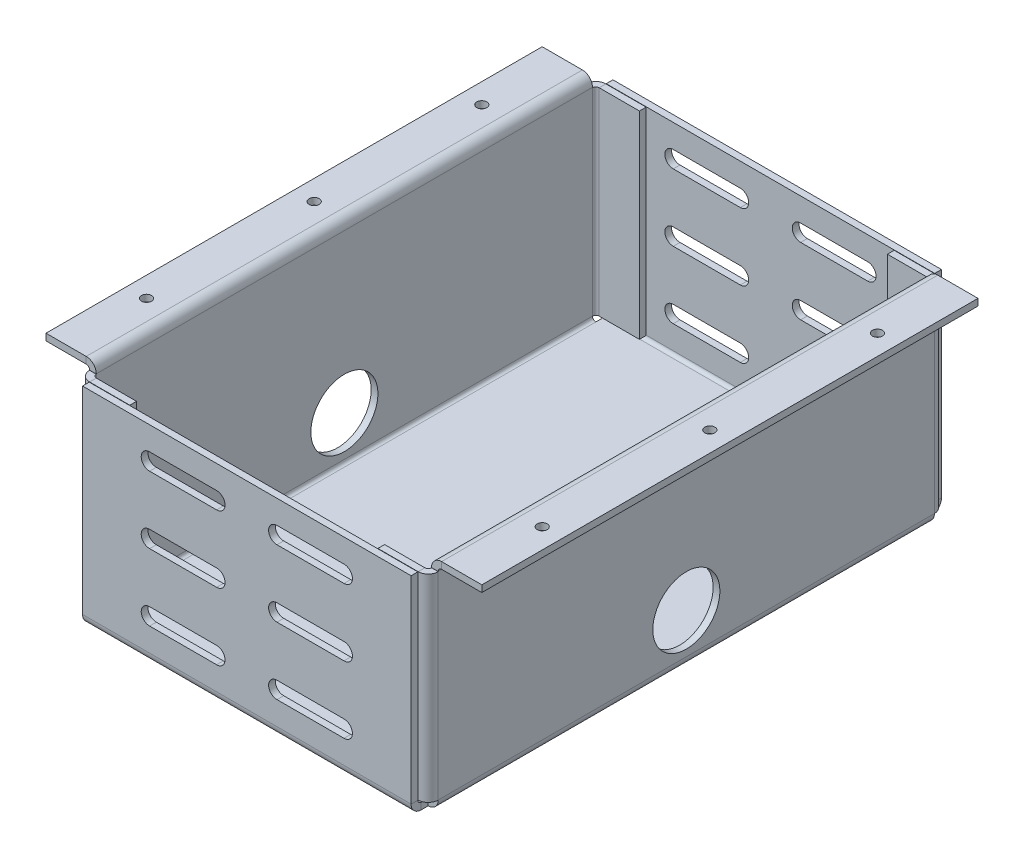
from build123d import *

# Parameters (mm, degrees)
BRIDA_BASE1_DEPTH           = 75
BRIDA_START                 = -3
BRIDA_DE_ARISTA1_OUTLINE_W  = 3
BRIDA_DE_ARISTA1_OUTLINE_H  = 1
BRIDA_DE_ARISTA1_DEPTH      = 4
BRIDA_START_2               = 1
BRIDA_DE_ARISTA1_2_DEPTH    = 59
BRIDA_DE_ARISTA1_3_DEPTH    = 59
BRIDA_DE_ARISTA3_DEPTH      = 98
BRIDA_DE_ARISTA4_DEPTH      = 98
BRIDA_DE_ARISTA5_DEPTH      = 148
BRIDA_DE_ARISTA5_BEND_DEPTH = 148
CORTAR_EXTRUIR1_REACH       = 122.264
CROQUIS32_R                 = 1.5
CORTAR_EXTRUIR2_REACH       = 184.302
DESDOBLAR1_OUTLINE_R        = 1.5
DESDOBLAR1_DEPTH            = 63.1
DESDOBLAR1_START            = -2
DESDOBLAR1_2_OUTLINE_R      = 1.5
DESDOBLAR1_2_DEPTH          = 2
DOBLAR1_START               = -2
DOBLAR1_OUTLINE_W           = 98
DOBLAR1_OUTLINE_H           = 59.141592654
DOBLAR1_OUTLINE_R           = 1.5
DOBLAR1_DEPTH               = 2
DOBLAR1_START_2             = 1
DOBLAR1_2_OUTLINE_W         = 98
DOBLAR1_2_OUTLINE_H         = 2
DOBLAR1_2_DEPTH             = 59
DOBLAR1_3_DEPTH             = 1
DOBLAR1_START_3             = 60.1
DOBLAR1_4_OUTLINE_W         = 15
DOBLAR1_4_OUTLINE_H         = 148
DOBLAR1_4_OUTLINE_R         = 1.5
DOBLAR1_4_DEPTH             = 3
DOBLAR1_5_OUTLINE_W         = 12
DOBLAR1_5_OUTLINE_H         = 2
DOBLAR1_5_DEPTH             = 0.68314
DOBLAR1_START_4             = 60
DOBLAR1_6_OUTLINE_W         = 2
DOBLAR1_6_OUTLINE_H         = 148
DOBLAR1_6_DEPTH             = 1.1
DOBLAR1_START_5             = -76.1
DOBLAR1_7_DEPTH             = 152.2
DOBLAR1_START_6             = -79.1
DOBLAR1_8_DEPTH             = 158.2
DOBLAR1_START_7             = -49
DOBLAR1_9_DEPTH             = 98
DOBLAR1_START_8             = -74
DOBLAR1_10_DEPTH            = 148
CORTAR_EXTRUIR3_REACH       = 156.685
CROQUIS38_R                 = 10


with BuildPart() as part:
    # Brida base1: sheet metal written as solids
    # Croquis1 → Brida base1 (new, symmetric)
    with BuildSketch(Plane.XY):
        with BuildLine():
            Line((50, 60), (50, 1))
            ThreePointArc((50, 1), (49.707106781, 0.292893219), (49, 0))
            Line((49, 0), (-49, 0))
            ThreePointArc((-49, 0), (-49.707106781, 0.292893219), (-50, 1))
            Line((-50, 1), (-50, 60))
            Line((-50, 60), (-52, 60))
            Line((-52, 60), (-52, 1))
            ThreePointArc((-52, 1), (-51.121320344, -1.121320344), (-49, -2))
            Line((-49, -2), (49, -2))
            ThreePointArc((49, -2), (51.121320344, -1.121320344), (52, 1))
            Line((52, 1), (52, 60))
            Line((52, 60), (50, 60))
        make_face()
    extrude(amount=BRIDA_BASE1_DEPTH, both=True)

    # Brida de arista1: read off the stored shape, not the designer's step
    # Brida de arista1 outline → Brida de arista1 (cut)
    with BuildSketch(Plane(origin=(0, 0, 0), x_dir=(1, 0, 0), z_dir=(0, 1, 0)).offset(BRIDA_START)):
        with Locations((50.5, 74.5)):
            Rectangle(BRIDA_DE_ARISTA1_OUTLINE_W, BRIDA_DE_ARISTA1_OUTLINE_H)
        with Locations((50.5, -74.5)):
            Rectangle(BRIDA_DE_ARISTA1_OUTLINE_W, BRIDA_DE_ARISTA1_OUTLINE_H)
        with Locations((-50.5, 74.5)):
            Rectangle(BRIDA_DE_ARISTA1_OUTLINE_W, BRIDA_DE_ARISTA1_OUTLINE_H)
        with Locations((-50.5, -74.5)):
            Rectangle(BRIDA_DE_ARISTA1_OUTLINE_W, BRIDA_DE_ARISTA1_OUTLINE_H)
    extrude(amount=BRIDA_DE_ARISTA1_DEPTH, mode=Mode.SUBTRACT)

    # Brida de arista1 2 outline → Brida de arista1 2 (cut)
    with BuildSketch(Plane(origin=(0, 0, 0), x_dir=(1, 0, 0), z_dir=(0, 1, 0)).offset(BRIDA_START_2)):
        with BuildLine():
            ThreePointArc((51.828427125, 75), (51.956795679, 74.507305936), (52, 74))
            Line((52, 74), (52, 75))
            Line((52, 75), (51.828427125, 75))
        make_face()
        with BuildLine():
            Line((52, -75), (52, -74))
            ThreePointArc((52, -74), (51.956795679, -74.507305936), (51.828427125, -75))
            Line((51.828427125, -75), (52, -75))
        make_face()
        with BuildLine():
            ThreePointArc((-52, 74), (-51.956795679, 74.507305936), (-51.828427125, 75))
            Line((-51.828427125, 75), (-52, 75))
            Line((-52, 75), (-52, 74))
        make_face()
        with BuildLine():
            ThreePointArc((-51.828427125, -75), (-51.956795679, -74.507305936), (-52, -74))
            Line((-52, -74), (-52, -75))
            Line((-52, -75), (-51.828427125, -75))
        make_face()
    extrude(amount=BRIDA_DE_ARISTA1_2_DEPTH, mode=Mode.SUBTRACT)

    # Brida de arista1 3 outline → Brida de arista1 3 (add)
    with BuildSketch(Plane(origin=(0, 0, 0), x_dir=(1, 0, 0), z_dir=(0, 1, 0)).offset(BRIDA_START_2)):
        with BuildLine():
            Line((50, 74), (50, 75))
            Line((50, 75), (51.828427125, 75))
            ThreePointArc((51.828427125, 75), (50.732050808, 76.449489743), (49, 77))
            Line((49, 77), (37, 77))
            Line((37, 77), (37, 75))
            Line((37, 75), (49, 75))
            ThreePointArc((49, 75), (49.707106781, 74.707106781), (50, 74))
        make_face()
        with BuildLine():
            Line((-49, 75), (-37, 75))
            Line((-37, 75), (-37, 77))
            Line((-37, 77), (-49, 77))
            ThreePointArc((-49, 77), (-50.732050808, 76.449489743), (-51.828427125, 75))
            Line((-51.828427125, 75), (-50, 75))
            Line((-50, 75), (-50, 74))
            ThreePointArc((-50, 74), (-49.707106781, 74.707106781), (-49, 75))
        make_face()
        with BuildLine():
            Line((50, -75), (50, -74))
            ThreePointArc((50, -74), (49.707106781, -74.707106781), (49, -75))
            Line((49, -75), (37, -75))
            Line((37, -75), (37, -77))
            Line((37, -77), (49, -77))
            ThreePointArc((49, -77), (50.732050808, -76.449489743), (51.828427125, -75))
            Line((51.828427125, -75), (50, -75))
        make_face()
        with BuildLine():
            ThreePointArc((-49, -75), (-49.707106781, -74.707106781), (-50, -74))
            Line((-50, -74), (-50, -75))
            Line((-50, -75), (-51.828427125, -75))
            ThreePointArc((-51.828427125, -75), (-50.732050808, -76.449489743), (-49, -77))
            Line((-49, -77), (-37, -77))
            Line((-37, -77), (-37, -75))
            Line((-37, -75), (-49, -75))
        make_face()
    extrude(amount=BRIDA_DE_ARISTA1_3_DEPTH)

    # Brida de arista3: sheet metal written as solids
    # Brida de arista3 section (on a plane across the edge) → Brida de arista3 (add)
    with BuildSketch(Plane(origin=(-49, 0, 77.1), x_dir=(0, 0, -1), z_dir=(1, 0, 0))):
        with BuildLine():
            Line((-2, 1), (-2, 60))
            Line((-2, 60), (0, 60))
            Line((0, 60), (0, 1))
            ThreePointArc((0, 1), (0.292893219, 0.292893219), (1, 0))
            Line((1, 0), (2.1, 0))
            Line((2.1, 0), (2.1, -2))
            Line((2.1, -2), (1, -2))
            ThreePointArc((1, -2), (-1.121320344, -1.121320344), (-2, 1))
        make_face()
    extrude(amount=BRIDA_DE_ARISTA3_DEPTH)

    # Brida de arista4: sheet metal written as solids
    # Brida de arista4 section (on a plane across the edge) → Brida de arista4 (add)
    with BuildSketch(Plane(origin=(49, 0, -77.1), x_dir=(0, 0, 1), z_dir=(-1, 0, 0))):
        with BuildLine():
            Line((-2, 1), (-2, 60))
            Line((-2, 60), (0, 60))
            Line((0, 60), (0, 1))
            ThreePointArc((0, 1), (0.292893219, 0.292893219), (1, 0))
            Line((1, 0), (2.1, 0))
            Line((2.1, 0), (2.1, -2))
            Line((2.1, -2), (1, -2))
            ThreePointArc((1, -2), (-1.121320344, -1.121320344), (-2, 1))
        make_face()
    extrude(amount=BRIDA_DE_ARISTA4_DEPTH)

    # Brida de arista5: sheet metal written as solids
    # Brida de arista5 section (on a plane across the edge) → Brida de arista5 (add)
    with BuildSketch(Plane(origin=(52, 61.1, -74), x_dir=(0, -1, 0), z_dir=(0, 0, 1))):
        with BuildLine():
            Line((-2, 1), (-2, 13))
            Line((-2, 13), (0, 13))
            Line((0, 13), (0, 1))
            ThreePointArc((0, 1), (0.292893219, 0.292893219), (1, 0))
            Line((1, 0), (1.1, 0))
            Line((1.1, 0), (1.1, -2))
            Line((1.1, -2), (1, -2))
            ThreePointArc((1, -2), (-1.121320344, -1.121320344), (-2, 1))
        make_face()
    extrude(amount=BRIDA_DE_ARISTA5_DEPTH)

    # Brida de arista5 section 2 (on a plane across the edge) → Brida de arista5 bend (add)
    with BuildSketch(Plane(origin=(-52, 61.1, 74), x_dir=(0, -1, 0), z_dir=(0, 0, -1))):
        with BuildLine():
            Line((-2, 1), (-2, 13))
            Line((-2, 13), (0, 13))
            Line((0, 13), (0, 1))
            ThreePointArc((0, 1), (0.292893219, 0.292893219), (1, 0))
            Line((1, 0), (1.1, 0))
            Line((1.1, 0), (1.1, -2))
            Line((1.1, -2), (1, -2))
            ThreePointArc((1, -2), (-1.121320344, -1.121320344), (-2, 1))
        make_face()
    extrude(amount=BRIDA_DE_ARISTA5_BEND_DEPTH)

    # Croquis32 → Cortar-Extruir1 (cut, up to next)
    with BuildSketch(Plane.XZ.offset(-61.1), mode=Mode.PRIVATE) as cortar_extruir1_sk1:
        with Locations((-59, 50)):
            Circle(CROQUIS32_R)
    cortar_extruir1_tool1 = extrude(cortar_extruir1_sk1.sketch, amount=-CORTAR_EXTRUIR1_REACH, mode=Mode.PRIVATE) & part.part
    # Croquis32 → Cortar-Extruir1 (cut, up to next)
    with BuildSketch(Plane.XZ.offset(-61.1), mode=Mode.PRIVATE) as cortar_extruir1_sk2:
        with Locations((-59, 0)):
            Circle(CROQUIS32_R)
    cortar_extruir1_tool2 = extrude(cortar_extruir1_sk2.sketch, amount=-CORTAR_EXTRUIR1_REACH, mode=Mode.PRIVATE) & part.part
    # Croquis32 → Cortar-Extruir1 (cut, up to next)
    with BuildSketch(Plane.XZ.offset(-61.1), mode=Mode.PRIVATE) as cortar_extruir1_sk3:
        with Locations((-59, -50)):
            Circle(CROQUIS32_R)
    cortar_extruir1_tool3 = extrude(cortar_extruir1_sk3.sketch, amount=-CORTAR_EXTRUIR1_REACH, mode=Mode.PRIVATE) & part.part
    # Croquis32 → Cortar-Extruir1 (cut, up to next)
    with BuildSketch(Plane.XZ.offset(-61.1), mode=Mode.PRIVATE) as cortar_extruir1_sk4:
        with Locations((59, -50)):
            Circle(CROQUIS32_R)
    cortar_extruir1_tool4 = extrude(cortar_extruir1_sk4.sketch, amount=-CORTAR_EXTRUIR1_REACH, mode=Mode.PRIVATE) & part.part
    # Croquis32 → Cortar-Extruir1 (cut, up to next)
    with BuildSketch(Plane.XZ.offset(-61.1), mode=Mode.PRIVATE) as cortar_extruir1_sk5:
        with Locations((59, 0)):
            Circle(CROQUIS32_R)
    cortar_extruir1_tool5 = extrude(cortar_extruir1_sk5.sketch, amount=-CORTAR_EXTRUIR1_REACH, mode=Mode.PRIVATE) & part.part
    # Croquis32 → Cortar-Extruir1 (cut, up to next)
    with BuildSketch(Plane.XZ.offset(-61.1), mode=Mode.PRIVATE) as cortar_extruir1_sk6:
        with Locations((59, 50)):
            Circle(CROQUIS32_R)
    cortar_extruir1_tool6 = extrude(cortar_extruir1_sk6.sketch, amount=-CORTAR_EXTRUIR1_REACH, mode=Mode.PRIVATE) & part.part
    add(cortar_extruir1_tool1.solids().sort_by_distance((-59, 61.1, 50))[0], mode=Mode.SUBTRACT)
    add(cortar_extruir1_tool2.solids().sort_by_distance((-59, 61.1, 0))[0], mode=Mode.SUBTRACT)
    add(cortar_extruir1_tool3.solids().sort_by_distance((-59, 61.1, -50))[0], mode=Mode.SUBTRACT)
    add(cortar_extruir1_tool4.solids().sort_by_distance((59, 61.1, -50))[0], mode=Mode.SUBTRACT)
    add(cortar_extruir1_tool5.solids().sort_by_distance((59, 61.1, 0))[0], mode=Mode.SUBTRACT)
    add(cortar_extruir1_tool6.solids().sort_by_distance((59, 61.1, 50))[0], mode=Mode.SUBTRACT)

    # Cortar-Extruir2: up to this face of the body (flat: up to its plane)
    cortar_extruir2_end = Plane(part.part.faces().sort_by_distance((0, 30.5, 79.1))[0])
    # Croquis33 → Cortar-Extruir2 (cut, up to the picked face)
    with BuildSketch(Plane(origin=(0, 0, -79.1), x_dir=(-1, 0, 0), z_dir=(0, 0, -1)), mode=Mode.PRIVATE) as cortar_extruir2_sk1:
        with BuildLine():
            Line((-29, 33), (-9, 33))
            ThreePointArc((-9, 33), (-6.5, 30.5), (-9, 28))
            Line((-9, 28), (-29, 28))
            ThreePointArc((-29, 28), (-31.5, 30.5), (-29, 33))
        make_face()
    cortar_extruir2_tool1 = split(extrude(cortar_extruir2_sk1.sketch, amount=-CORTAR_EXTRUIR2_REACH, mode=Mode.PRIVATE), bisect_by=cortar_extruir2_end, keep=Keep.BOTH, mode=Mode.PRIVATE)
    # Croquis33 → Cortar-Extruir2 (cut, up to the picked face)
    with BuildSketch(Plane(origin=(0, 0, -79.1), x_dir=(-1, 0, 0), z_dir=(0, 0, -1)), mode=Mode.PRIVATE) as cortar_extruir2_sk2:
        with BuildLine():
            Line((-9, 48), (-29, 48))
            ThreePointArc((-29, 48), (-31.5, 50.5), (-29, 53))
            Line((-29, 53), (-9, 53))
            ThreePointArc((-9, 53), (-6.5, 50.5), (-9, 48))
        make_face()
    cortar_extruir2_tool2 = split(extrude(cortar_extruir2_sk2.sketch, amount=-CORTAR_EXTRUIR2_REACH, mode=Mode.PRIVATE), bisect_by=cortar_extruir2_end, keep=Keep.BOTH, mode=Mode.PRIVATE)
    # Croquis33 → Cortar-Extruir2 (cut, up to the picked face)
    with BuildSketch(Plane(origin=(0, 0, -79.1), x_dir=(-1, 0, 0), z_dir=(0, 0, -1)), mode=Mode.PRIVATE) as cortar_extruir2_sk3:
        with BuildLine():
            Line((-29, 13), (-9, 13))
            ThreePointArc((-9, 13), (-6.5, 10.5), (-9, 8))
            Line((-9, 8), (-29, 8))
            ThreePointArc((-29, 8), (-31.5, 10.5), (-29, 13))
        make_face()
    cortar_extruir2_tool3 = split(extrude(cortar_extruir2_sk3.sketch, amount=-CORTAR_EXTRUIR2_REACH, mode=Mode.PRIVATE), bisect_by=cortar_extruir2_end, keep=Keep.BOTH, mode=Mode.PRIVATE)
    # Croquis33 → Cortar-Extruir2 (cut, up to the picked face)
    with BuildSketch(Plane(origin=(0, 0, -79.1), x_dir=(-1, 0, 0), z_dir=(0, 0, -1)), mode=Mode.PRIVATE) as cortar_extruir2_sk4:
        with BuildLine():
            Line((29, 13), (9, 13))
            ThreePointArc((9, 13), (6.5, 10.5), (9, 8))
            Line((9, 8), (29, 8))
            ThreePointArc((29, 8), (31.5, 10.5), (29, 13))
        make_face()
    cortar_extruir2_tool4 = split(extrude(cortar_extruir2_sk4.sketch, amount=-CORTAR_EXTRUIR2_REACH, mode=Mode.PRIVATE), bisect_by=cortar_extruir2_end, keep=Keep.BOTH, mode=Mode.PRIVATE)
    # Croquis33 → Cortar-Extruir2 (cut, up to the picked face)
    with BuildSketch(Plane(origin=(0, 0, -79.1), x_dir=(-1, 0, 0), z_dir=(0, 0, -1)), mode=Mode.PRIVATE) as cortar_extruir2_sk5:
        with BuildLine():
            Line((29, 33), (9, 33))
            ThreePointArc((9, 33), (6.5, 30.5), (9, 28))
            Line((9, 28), (29, 28))
            ThreePointArc((29, 28), (31.5, 30.5), (29, 33))
        make_face()
    cortar_extruir2_tool5 = split(extrude(cortar_extruir2_sk5.sketch, amount=-CORTAR_EXTRUIR2_REACH, mode=Mode.PRIVATE), bisect_by=cortar_extruir2_end, keep=Keep.BOTH, mode=Mode.PRIVATE)
    # Croquis33 → Cortar-Extruir2 (cut, up to the picked face)
    with BuildSketch(Plane(origin=(0, 0, -79.1), x_dir=(-1, 0, 0), z_dir=(0, 0, -1)), mode=Mode.PRIVATE) as cortar_extruir2_sk6:
        with BuildLine():
            Line((9, 48), (29, 48))
            ThreePointArc((29, 48), (31.5, 50.5), (29, 53))
            Line((29, 53), (9, 53))
            ThreePointArc((9, 53), (6.5, 50.5), (9, 48))
        make_face()
    cortar_extruir2_tool6 = split(extrude(cortar_extruir2_sk6.sketch, amount=-CORTAR_EXTRUIR2_REACH, mode=Mode.PRIVATE), bisect_by=cortar_extruir2_end, keep=Keep.BOTH, mode=Mode.PRIVATE)
    add(cortar_extruir2_tool1.solids().sort_by(Axis((19, 30.5, -79.1), (0, 0, 1)))[0], mode=Mode.SUBTRACT)
    add(cortar_extruir2_tool2.solids().sort_by(Axis((19, 50.5, -79.1), (0, 0, 1)))[0], mode=Mode.SUBTRACT)
    add(cortar_extruir2_tool3.solids().sort_by(Axis((19, 10.5, -79.1), (0, 0, 1)))[0], mode=Mode.SUBTRACT)
    add(cortar_extruir2_tool4.solids().sort_by(Axis((-19, 10.5, -79.1), (0, 0, 1)))[0], mode=Mode.SUBTRACT)
    add(cortar_extruir2_tool5.solids().sort_by(Axis((-19, 30.5, -79.1), (0, 0, 1)))[0], mode=Mode.SUBTRACT)
    add(cortar_extruir2_tool6.solids().sort_by(Axis((-19, 50.5, -79.1), (0, 0, 1)))[0], mode=Mode.SUBTRACT)

    # Desdoblar1: read off the stored shape, not the designer's step
    # Desdoblar1 outline → Desdoblar1 (cut)
    with BuildSketch(Plane(origin=(0, 0, 0), x_dir=(1, 0, 0), z_dir=(0, 1, 0))):
        with BuildLine():
            Line((-49, -79.1), (49, -79.1))
            Line((49, -79.1), (49, -77))
            ThreePointArc((49, -77), (51.121320344, -76.121320344), (52, -74))
            Line((52, -74), (65, -74))
            Line((65, -74), (65, 74))
            Line((65, 74), (52, 74))
            ThreePointArc((52, 74), (51.121320344, 76.121320344), (49, 77))
            Line((49, 77), (49, 79.1))
            Line((49, 79.1), (-49, 79.1))
            Line((-49, 79.1), (-49, 77))
            ThreePointArc((-49, 77), (-51.121320344, 76.121320344), (-52, 74))
            Line((-52, 74), (-65, 74))
            Line((-65, 74), (-65, -74))
            Line((-65, -74), (-52, -74))
            ThreePointArc((-52, -74), (-51.121320344, -76.121320344), (-49, -77))
            Line((-49, -77), (-49, -79.1))
        make_face()
        with BuildLine():
            Line((-49, -74), (-49, -75))
            ThreePointArc((-49, -75), (-49.707106781, -74.707106781), (-50, -74))
            Line((-50, -74), (-49, -74))
        make_face(mode=Mode.SUBTRACT)
        with BuildLine():
            Line((-49, 74), (-50, 74))
            ThreePointArc((-50, 74), (-49.707106781, 74.707106781), (-49, 75))
            Line((-49, 75), (-49, 74))
        make_face(mode=Mode.SUBTRACT)
        with BuildLine():
            Line((49, 74), (49, 75))
            ThreePointArc((49, 75), (49.707106781, 74.707106781), (50, 74))
            Line((50, 74), (49, 74))
        make_face(mode=Mode.SUBTRACT)
        with BuildLine():
            Line((49, -74), (50, -74))
            ThreePointArc((50, -74), (49.707106781, -74.707106781), (49, -75))
            Line((49, -75), (49, -74))
        make_face(mode=Mode.SUBTRACT)
        with Locations((-59, 50)):
            Circle(DESDOBLAR1_OUTLINE_R, mode=Mode.SUBTRACT)
        with Locations((-59, -50)):
            Circle(DESDOBLAR1_OUTLINE_R, mode=Mode.SUBTRACT)
        with Locations((-59, 0)):
            Circle(DESDOBLAR1_OUTLINE_R, mode=Mode.SUBTRACT)
        with Locations((59, 50)):
            Circle(DESDOBLAR1_OUTLINE_R, mode=Mode.SUBTRACT)
        with Locations((59, -50)):
            Circle(DESDOBLAR1_OUTLINE_R, mode=Mode.SUBTRACT)
        with Locations((59, 0)):
            Circle(DESDOBLAR1_OUTLINE_R, mode=Mode.SUBTRACT)
    extrude(amount=DESDOBLAR1_DEPTH, mode=Mode.SUBTRACT)

    # Desdoblar1 2 outline → Desdoblar1 2 (add)
    with BuildSketch(Plane(origin=(0, 0, 0), x_dir=(1, 0, 0), z_dir=(0, 1, 0)).offset(DESDOBLAR1_START)):
        Polygon((49, -138.241592654), (49, -74), (52.141592654, -74), (52.141592654, -89.141592654), (111.141592654, -89.141592654), (111.141592654, -74), (126.383185307, -74), (126.383185307, 74), (111.141592654, 74), (111.141592654, 89.141592654), (52.141592654, 89.141592654), (52.141592654, 74), (49, 74), (49, 138.241592654), (-49, 138.241592654), (-49, 74), (-52.141592654, 74), (-52.141592654, 89.141592654), (-111.141592654, 89.141592654), (-111.141592654, 74), (-126.383185307, 74), (-126.383185307, -74), (-111.141592654, -74), (-111.141592654, -89.141592654), (-52.141592654, -89.141592654), (-52.141592654, -74), (-49, -74), (-49, -138.241592654), align=None)
        with BuildLine():
            Line((-29, -126.241592654), (-9, -126.241592654))
            ThreePointArc((-9, -126.241592654), (-6.5, -128.741592654), (-9, -131.241592654))
            Line((-9, -131.241592654), (-29, -131.241592654))
            ThreePointArc((-29, -131.241592654), (-31.5, -128.741592654), (-29, -126.241592654))
        make_face(mode=Mode.SUBTRACT)
        with BuildLine():
            Line((-29, -106.241592654), (-9, -106.241592654))
            ThreePointArc((-9, -106.241592654), (-6.5, -108.741592654), (-9, -111.241592654))
            Line((-9, -111.241592654), (-29, -111.241592654))
            ThreePointArc((-29, -111.241592654), (-31.5, -108.741592654), (-29, -106.241592654))
        make_face(mode=Mode.SUBTRACT)
        with BuildLine():
            Line((-9, -91.241592654), (-29, -91.241592654))
            ThreePointArc((-29, -91.241592654), (-31.5, -88.741592654), (-29, -86.241592654))
            Line((-29, -86.241592654), (-9, -86.241592654))
            ThreePointArc((-9, -86.241592654), (-6.5, -88.741592654), (-9, -91.241592654))
        make_face(mode=Mode.SUBTRACT)
        with BuildLine():
            Line((9, -126.241592654), (29, -126.241592654))
            ThreePointArc((29, -126.241592654), (31.5, -128.741592654), (29, -131.241592654))
            Line((29, -131.241592654), (9, -131.241592654))
            ThreePointArc((9, -131.241592654), (6.5, -128.741592654), (9, -126.241592654))
        make_face(mode=Mode.SUBTRACT)
        with BuildLine():
            Line((9, -106.241592654), (29, -106.241592654))
            ThreePointArc((29, -106.241592654), (31.5, -108.741592654), (29, -111.241592654))
            Line((29, -111.241592654), (9, -111.241592654))
            ThreePointArc((9, -111.241592654), (6.5, -108.741592654), (9, -106.241592654))
        make_face(mode=Mode.SUBTRACT)
        with BuildLine():
            Line((29, -91.241592654), (9, -91.241592654))
            ThreePointArc((9, -91.241592654), (6.5, -88.741592654), (9, -86.241592654))
            Line((9, -86.241592654), (29, -86.241592654))
            ThreePointArc((29, -86.241592654), (31.5, -88.741592654), (29, -91.241592654))
        make_face(mode=Mode.SUBTRACT)
        with BuildLine():
            ThreePointArc((29, 131.241592654), (31.5, 128.741592654), (29, 126.241592654))
            Line((29, 126.241592654), (9, 126.241592654))
            ThreePointArc((9, 126.241592654), (6.5, 128.741592654), (9, 131.241592654))
            Line((9, 131.241592654), (29, 131.241592654))
        make_face(mode=Mode.SUBTRACT)
        with BuildLine():
            Line((-9, 86.241592654), (-29, 86.241592654))
            ThreePointArc((-29, 86.241592654), (-31.5, 88.741592654), (-29, 91.241592654))
            Line((-29, 91.241592654), (-9, 91.241592654))
            ThreePointArc((-9, 91.241592654), (-6.5, 88.741592654), (-9, 86.241592654))
        make_face(mode=Mode.SUBTRACT)
        with BuildLine():
            Line((-29, 111.241592654), (-9, 111.241592654))
            ThreePointArc((-9, 111.241592654), (-6.5, 108.741592654), (-9, 106.241592654))
            Line((-9, 106.241592654), (-29, 106.241592654))
            ThreePointArc((-29, 106.241592654), (-31.5, 108.741592654), (-29, 111.241592654))
        make_face(mode=Mode.SUBTRACT)
        with BuildLine():
            Line((-29, 131.241592654), (-9, 131.241592654))
            ThreePointArc((-9, 131.241592654), (-6.5, 128.741592654), (-9, 126.241592654))
            Line((-9, 126.241592654), (-29, 126.241592654))
            ThreePointArc((-29, 126.241592654), (-31.5, 128.741592654), (-29, 131.241592654))
        make_face(mode=Mode.SUBTRACT)
        with BuildLine():
            Line((29, 86.241592654), (9, 86.241592654))
            ThreePointArc((9, 86.241592654), (6.5, 88.741592654), (9, 91.241592654))
            Line((9, 91.241592654), (29, 91.241592654))
            ThreePointArc((29, 91.241592654), (31.5, 88.741592654), (29, 86.241592654))
        make_face(mode=Mode.SUBTRACT)
        with BuildLine():
            Line((9, 111.241592654), (29, 111.241592654))
            ThreePointArc((29, 111.241592654), (31.5, 108.741592654), (29, 106.241592654))
            Line((29, 106.241592654), (9, 106.241592654))
            ThreePointArc((9, 106.241592654), (6.5, 108.741592654), (9, 111.241592654))
        make_face(mode=Mode.SUBTRACT)
        with Locations((-120.383185307, 0)):
            Circle(DESDOBLAR1_2_OUTLINE_R, mode=Mode.SUBTRACT)
        with Locations((-120.383185307, 50)):
            Circle(DESDOBLAR1_2_OUTLINE_R, mode=Mode.SUBTRACT)
        with Locations((-120.383185307, -50)):
            Circle(DESDOBLAR1_2_OUTLINE_R, mode=Mode.SUBTRACT)
        with Locations((120.383185307, -50)):
            Circle(DESDOBLAR1_2_OUTLINE_R, mode=Mode.SUBTRACT)
        with Locations((120.383185307, 0)):
            Circle(DESDOBLAR1_2_OUTLINE_R, mode=Mode.SUBTRACT)
        with Locations((120.383185307, 50)):
            Circle(DESDOBLAR1_2_OUTLINE_R, mode=Mode.SUBTRACT)
    extrude(amount=DESDOBLAR1_2_DEPTH)

    # Doblar1: read off the stored shape, not the designer's step
    # Doblar1 outline → Doblar1 (cut)
    # profile 1 of 4: a face of its own
    with BuildSketch(Plane(origin=(0, 0, 0), x_dir=(1, 0, 0), z_dir=(0, 1, 0)).offset(DOBLAR1_START)):
        with Locations((0, 108.670796327)):
            Rectangle(DOBLAR1_OUTLINE_W, DOBLAR1_OUTLINE_H)
        with BuildLine():
            Line((-9, 86.241592654), (-29, 86.241592654))
            ThreePointArc((-29, 86.241592654), (-31.5, 88.741592654), (-29, 91.241592654))
            Line((-29, 91.241592654), (-9, 91.241592654))
            ThreePointArc((-9, 91.241592654), (-6.5, 88.741592654), (-9, 86.241592654))
        make_face(mode=Mode.SUBTRACT)
        with BuildLine():
            Line((-29, 111.241592654), (-9, 111.241592654))
            ThreePointArc((-9, 111.241592654), (-6.5, 108.741592654), (-9, 106.241592654))
            Line((-9, 106.241592654), (-29, 106.241592654))
            ThreePointArc((-29, 106.241592654), (-31.5, 108.741592654), (-29, 111.241592654))
        make_face(mode=Mode.SUBTRACT)
        with BuildLine():
            Line((-29, 131.241592654), (-9, 131.241592654))
            ThreePointArc((-9, 131.241592654), (-6.5, 128.741592654), (-9, 126.241592654))
            Line((-9, 126.241592654), (-29, 126.241592654))
            ThreePointArc((-29, 126.241592654), (-31.5, 128.741592654), (-29, 131.241592654))
        make_face(mode=Mode.SUBTRACT)
        with BuildLine():
            Line((29, 86.241592654), (9, 86.241592654))
            ThreePointArc((9, 86.241592654), (6.5, 88.741592654), (9, 91.241592654))
            Line((9, 91.241592654), (29, 91.241592654))
            ThreePointArc((29, 91.241592654), (31.5, 88.741592654), (29, 86.241592654))
        make_face(mode=Mode.SUBTRACT)
        with BuildLine():
            Line((9, 111.241592654), (29, 111.241592654))
            ThreePointArc((29, 111.241592654), (31.5, 108.741592654), (29, 106.241592654))
            Line((29, 106.241592654), (9, 106.241592654))
            ThreePointArc((9, 106.241592654), (6.5, 108.741592654), (9, 111.241592654))
        make_face(mode=Mode.SUBTRACT)
        with BuildLine():
            Line((9, 131.241592654), (29, 131.241592654))
            ThreePointArc((29, 131.241592654), (31.5, 128.741592654), (29, 126.241592654))
            Line((29, 126.241592654), (9, 126.241592654))
            ThreePointArc((9, 126.241592654), (6.5, 128.741592654), (9, 131.241592654))
        make_face(mode=Mode.SUBTRACT)
    # profile 2 of 4: a face of its own
    with BuildSketch(Plane(origin=(0, 0, 0), x_dir=(1, 0, 0), z_dir=(0, 1, 0)).offset(DOBLAR1_START)):
        Polygon((52.141592654, 74), (52, 74), (52, -74), (52.141592654, -74), (52.141592654, -89.141592654), (111.141592654, -89.141592654), (111.141592654, -74), (126.383185307, -74), (126.383185307, 74), (111.141592654, 74), (111.141592654, 89.141592654), (52.141592654, 89.141592654), align=None)
        with Locations((120.383185307, 0)):
            Circle(DOBLAR1_OUTLINE_R, mode=Mode.SUBTRACT)
        with Locations((120.383185307, 50)):
            Circle(DOBLAR1_OUTLINE_R, mode=Mode.SUBTRACT)
        with Locations((120.383185307, -50)):
            Circle(DOBLAR1_OUTLINE_R, mode=Mode.SUBTRACT)
    # profile 3 of 4: a face of its own
    with BuildSketch(Plane(origin=(0, 0, 0), x_dir=(1, 0, 0), z_dir=(0, 1, 0)).offset(DOBLAR1_START)):
        Polygon((-52, -74), (-52, 74), (-52.141592654, 74), (-52.141592654, 89.141592654), (-111.141592654, 89.141592654), (-111.141592654, 74), (-126.383185307, 74), (-126.383185307, -74), (-111.141592654, -74), (-111.141592654, -89.141592654), (-52.141592654, -89.141592654), (-52.141592654, -74), align=None)
        with Locations((-120.383185307, -50)):
            Circle(DOBLAR1_OUTLINE_R, mode=Mode.SUBTRACT)
        with Locations((-120.383185307, 0)):
            Circle(DOBLAR1_OUTLINE_R, mode=Mode.SUBTRACT)
        with Locations((-120.383185307, 50)):
            Circle(DOBLAR1_OUTLINE_R, mode=Mode.SUBTRACT)
    # profile 4 of 4: a face of its own
    with BuildSketch(Plane(origin=(0, 0, 0), x_dir=(1, 0, 0), z_dir=(0, 1, 0)).offset(DOBLAR1_START)):
        with Locations((0, -108.670796327)):
            Rectangle(DOBLAR1_OUTLINE_W, DOBLAR1_OUTLINE_H)
        with BuildLine():
            Line((-29, -126.241592654), (-9, -126.241592654))
            ThreePointArc((-9, -126.241592654), (-6.5, -128.741592654), (-9, -131.241592654))
            Line((-9, -131.241592654), (-29, -131.241592654))
            ThreePointArc((-29, -131.241592654), (-31.5, -128.741592654), (-29, -126.241592654))
        make_face(mode=Mode.SUBTRACT)
        with BuildLine():
            Line((-29, -106.241592654), (-9, -106.241592654))
            ThreePointArc((-9, -106.241592654), (-6.5, -108.741592654), (-9, -111.241592654))
            Line((-9, -111.241592654), (-29, -111.241592654))
            ThreePointArc((-29, -111.241592654), (-31.5, -108.741592654), (-29, -106.241592654))
        make_face(mode=Mode.SUBTRACT)
        with BuildLine():
            Line((-9, -91.241592654), (-29, -91.241592654))
            ThreePointArc((-29, -91.241592654), (-31.5, -88.741592654), (-29, -86.241592654))
            Line((-29, -86.241592654), (-9, -86.241592654))
            ThreePointArc((-9, -86.241592654), (-6.5, -88.741592654), (-9, -91.241592654))
        make_face(mode=Mode.SUBTRACT)
        with BuildLine():
            Line((9, -126.241592654), (29, -126.241592654))
            ThreePointArc((29, -126.241592654), (31.5, -128.741592654), (29, -131.241592654))
            Line((29, -131.241592654), (9, -131.241592654))
            ThreePointArc((9, -131.241592654), (6.5, -128.741592654), (9, -126.241592654))
        make_face(mode=Mode.SUBTRACT)
        with BuildLine():
            Line((9, -106.241592654), (29, -106.241592654))
            ThreePointArc((29, -106.241592654), (31.5, -108.741592654), (29, -111.241592654))
            Line((29, -111.241592654), (9, -111.241592654))
            ThreePointArc((9, -111.241592654), (6.5, -108.741592654), (9, -106.241592654))
        make_face(mode=Mode.SUBTRACT)
        with BuildLine():
            Line((29, -91.241592654), (9, -91.241592654))
            ThreePointArc((9, -91.241592654), (6.5, -88.741592654), (9, -86.241592654))
            Line((9, -86.241592654), (29, -86.241592654))
            ThreePointArc((29, -86.241592654), (31.5, -88.741592654), (29, -91.241592654))
        make_face(mode=Mode.SUBTRACT)
    extrude(amount=DOBLAR1_DEPTH, mode=Mode.SUBTRACT)



with BuildPart() as body_2:
    # Doblar1 2 outline → Doblar1 2 (new body)
    with BuildSketch(Plane(origin=(0, 0, 0), x_dir=(1, 0, 0), z_dir=(0, 1, 0)).offset(DOBLAR1_START_2)):
        with Locations((0, 78.1)):
            Rectangle(DOBLAR1_2_OUTLINE_W, DOBLAR1_2_OUTLINE_H)
        with BuildLine():
            ThreePointArc((52, 74), (51.121320344, 76.121320344), (49, 77))
            Line((49, 77), (37, 77))
            Line((37, 77), (37, 75))
            Line((37, 75), (49, 75))
            ThreePointArc((49, 75), (49.707106781, 74.707106781), (50, 74))
            Line((50, 74), (50, -74))
            ThreePointArc((50, -74), (49.707106781, -74.707106781), (49, -75))
            Line((49, -75), (37, -75))
            Line((37, -75), (37, -77))
            Line((37, -77), (49, -77))
            ThreePointArc((49, -77), (51.121320344, -76.121320344), (52, -74))
            Line((52, -74), (52, 74))
        make_face()
        with BuildLine():
            Line((-37, 77), (-49, 77))
            ThreePointArc((-49, 77), (-51.121320344, 76.121320344), (-52, 74))
            Line((-52, 74), (-52, -74))
            ThreePointArc((-52, -74), (-51.121320344, -76.121320344), (-49, -77))
            Line((-49, -77), (-37, -77))
            Line((-37, -77), (-37, -75))
            Line((-37, -75), (-49, -75))
            ThreePointArc((-49, -75), (-49.707106781, -74.707106781), (-50, -74))
            Line((-50, -74), (-50, 74))
            ThreePointArc((-50, 74), (-49.707106781, 74.707106781), (-49, 75))
            Line((-49, 75), (-37, 75))
            Line((-37, 75), (-37, 77))
        make_face()
        with Locations((0, -78.1)):
            Rectangle(DOBLAR1_2_OUTLINE_W, DOBLAR1_2_OUTLINE_H)
    extrude(amount=DOBLAR1_2_DEPTH)


with BuildPart() as part_1:
    add(part.part)

    add(body_2.part)  # Doblar1 3 merges body 2
    # Doblar1 3 outline → Doblar1 3 (add)
    with BuildSketch(Plane(origin=(0, 0, 0), x_dir=(1, 0, 0), z_dir=(0, 1, 0))):
        Polygon((49, 79.1), (-49, 79.1), (-49, 77), (-37, 77), (-37, 75), (-49, 75), (-49, 74), (-52, 74), (-52, -74), (-49, -74), (-49, -75), (-37, -75), (-37, -77), (-49, -77), (-49, -79.1), (49, -79.1), (49, -77), (37, -77), (37, -75), (49, -75), (49, -74), (52, -74), (52, 74), (49, 74), (49, 75), (37, 75), (37, 77), (49, 77), align=None)
    extrude(amount=DOBLAR1_3_DEPTH)

    # Doblar1 5 outline → Doblar1 5 (add)
    with BuildSketch(Plane(origin=(0, 0, 0), x_dir=(1, 0, 0), z_dir=(0, 1, 0))):
        with Locations((43, 76)):
            Rectangle(DOBLAR1_5_OUTLINE_W, DOBLAR1_5_OUTLINE_H)
        with Locations((-43, 76)):
            Rectangle(DOBLAR1_5_OUTLINE_W, DOBLAR1_5_OUTLINE_H)
        with Locations((43, -76)):
            Rectangle(DOBLAR1_5_OUTLINE_W, DOBLAR1_5_OUTLINE_H)
        with Locations((-43, -76)):
            Rectangle(DOBLAR1_5_OUTLINE_W, DOBLAR1_5_OUTLINE_H)
    extrude(amount=DOBLAR1_5_DEPTH)



with BuildPart() as body_2_2:
    # Doblar1 4 outline → Doblar1 4 (new body)
    # profile 1 of 2: a face of its own
    with BuildSketch(Plane(origin=(0, 0, 0), x_dir=(1, 0, 0), z_dir=(0, 1, 0)).offset(DOBLAR1_START_3)):
        with Locations((57.5, 0)):
            Rectangle(DOBLAR1_4_OUTLINE_W, DOBLAR1_4_OUTLINE_H)
        with Locations((59, 50)):
            Circle(DOBLAR1_4_OUTLINE_R, mode=Mode.SUBTRACT)
        with Locations((59, -50)):
            Circle(DOBLAR1_4_OUTLINE_R, mode=Mode.SUBTRACT)
        with Locations((59, 0)):
            Circle(DOBLAR1_4_OUTLINE_R, mode=Mode.SUBTRACT)
    # profile 2 of 2: a face of its own
    with BuildSketch(Plane(origin=(0, 0, 0), x_dir=(1, 0, 0), z_dir=(0, 1, 0)).offset(DOBLAR1_START_3)):
        with Locations((-57.5, 0)):
            Rectangle(DOBLAR1_4_OUTLINE_W, DOBLAR1_4_OUTLINE_H)
        with Locations((-59, -50)):
            Circle(DOBLAR1_4_OUTLINE_R, mode=Mode.SUBTRACT)
        with Locations((-59, 0)):
            Circle(DOBLAR1_4_OUTLINE_R, mode=Mode.SUBTRACT)
        with Locations((-59, 50)):
            Circle(DOBLAR1_4_OUTLINE_R, mode=Mode.SUBTRACT)
    extrude(amount=DOBLAR1_4_DEPTH)


with BuildPart() as part_2:
    add(part_1.part)

    add(body_2_2.part)  # Doblar1 6 merges body 2 2
    # Doblar1 6 outline → Doblar1 6 (add)
    with BuildSketch(Plane(origin=(0, 0, 0), x_dir=(1, 0, 0), z_dir=(0, 1, 0)).offset(DOBLAR1_START_4)):
        with Locations((51, 0)):
            Rectangle(DOBLAR1_6_OUTLINE_W, DOBLAR1_6_OUTLINE_H)
        with Locations((-51, 0)):
            Rectangle(DOBLAR1_6_OUTLINE_W, DOBLAR1_6_OUTLINE_H)
    extrude(amount=DOBLAR1_6_DEPTH)

    # Doblar1 7 outline → Doblar1 7 (cut)
    with BuildSketch(Plane.XY.offset(DOBLAR1_START_5)):
        with BuildLine():
            Line((50, 1), (-50, 1))
            ThreePointArc((-50, 1), (-49.707106781, 0.292893219), (-49, 0))
            Line((-49, 0), (49, 0))
            ThreePointArc((49, 0), (49.707106781, 0.292893219), (50, 1))
        make_face()
        with BuildLine():
            Line((-53, 61.1), (-65, 61.1))
            Line((-65, 61.1), (-65, 60.1))
            Line((-65, 60.1), (-52, 60.1))
            ThreePointArc((-52, 60.1), (-52.292893219, 60.807106781), (-53, 61.1))
        make_face()
        with BuildLine():
            Line((65, 61.1), (53, 61.1))
            ThreePointArc((53, 61.1), (52.292893219, 60.807106781), (52, 60.1))
            Line((52, 60.1), (65, 60.1))
            Line((65, 60.1), (65, 61.1))
        make_face()
    extrude(amount=DOBLAR1_7_DEPTH, mode=Mode.SUBTRACT)

    # Doblar1 8 outline → Doblar1 8 (cut)
    with BuildSketch(Plane.XY.offset(DOBLAR1_START_6)):
        with BuildLine():
            ThreePointArc((29, 28), (31.5, 30.5), (29, 33))
            Line((29, 33), (9, 33))
            ThreePointArc((9, 33), (6.5, 30.5), (9, 28))
            Line((9, 28), (29, 28))
        make_face()
        with BuildLine():
            ThreePointArc((-9, 28), (-6.5, 30.5), (-9, 33))
            Line((-9, 33), (-29, 33))
            ThreePointArc((-29, 33), (-31.5, 30.5), (-29, 28))
            Line((-29, 28), (-9, 28))
        make_face()
        with BuildLine():
            ThreePointArc((-9, 48), (-6.5, 50.5), (-9, 53))
            Line((-9, 53), (-29, 53))
            ThreePointArc((-29, 53), (-31.5, 50.5), (-29, 48))
            Line((-29, 48), (-9, 48))
        make_face()
        with BuildLine():
            ThreePointArc((29, 48), (31.5, 50.5), (29, 53))
            Line((29, 53), (9, 53))
            ThreePointArc((9, 53), (6.5, 50.5), (9, 48))
            Line((9, 48), (29, 48))
        make_face()
        with BuildLine():
            ThreePointArc((-29, 13), (-31.5, 10.5), (-29, 8))
            Line((-29, 8), (-9, 8))
            ThreePointArc((-9, 8), (-6.5, 10.5), (-9, 13))
            Line((-9, 13), (-29, 13))
        make_face()
        with BuildLine():
            ThreePointArc((9, 13), (6.5, 10.5), (9, 8))
            Line((9, 8), (29, 8))
            ThreePointArc((29, 8), (31.5, 10.5), (29, 13))
            Line((29, 13), (9, 13))
        make_face()
    extrude(amount=DOBLAR1_8_DEPTH, mode=Mode.SUBTRACT)

    # Doblar1 9 outline → Doblar1 9 (cut)
    with BuildSketch(Plane.YZ.offset(DOBLAR1_START_7)):
        with BuildLine():
            ThreePointArc((0, -76.1), (0.292893219, -76.807106781), (1, -77.1))
            Line((1, -77.1), (1, -76.1))
            Line((1, -76.1), (0, -76.1))
        make_face()
        with BuildLine():
            Line((-2, -79.1), (1, -79.1))
            ThreePointArc((1, -79.1), (-1.121320344, -78.221320344), (-2, -76.1))
            Line((-2, -76.1), (-2, -79.1))
        make_face()
        with BuildLine():
            Line((-2, 79.1), (-2, 76.1))
            ThreePointArc((-2, 76.1), (-1.121320344, 78.221320344), (1, 79.1))
            Line((1, 79.1), (-2, 79.1))
        make_face()
        with BuildLine():
            ThreePointArc((1, 77.1), (0.292893219, 76.807106781), (0, 76.1))
            Line((0, 76.1), (1, 76.1))
            Line((1, 76.1), (1, 77.1))
        make_face()
    extrude(amount=DOBLAR1_9_DEPTH, mode=Mode.SUBTRACT)

    # Doblar1 10 outline → Doblar1 10 (cut)
    with BuildSketch(Plane.XY.offset(DOBLAR1_START_8)):
        with BuildLine():
            ThreePointArc((52, 1), (51.121320344, -1.121320344), (49, -2))
            Line((49, -2), (52, -2))
            Line((52, -2), (52, 1))
        make_face()
        with BuildLine():
            ThreePointArc((-49, -2), (-51.121320344, -1.121320344), (-52, 1))
            Line((-52, 1), (-52, -2))
            Line((-52, -2), (-49, -2))
        make_face()
        with BuildLine():
            ThreePointArc((-53, 63.1), (-50.878679656, 62.221320344), (-50, 60.1))
            Line((-50, 60.1), (-50, 63.1))
            Line((-50, 63.1), (-53, 63.1))
        make_face()
        with BuildLine():
            Line((50, 63.1), (50, 60.1))
            ThreePointArc((50, 60.1), (50.878679656, 62.221320344), (53, 63.1))
            Line((53, 63.1), (50, 63.1))
        make_face()
    extrude(amount=DOBLAR1_10_DEPTH, mode=Mode.SUBTRACT)

    # Cortar-Extruir3: up to this face of the body (flat: up to its plane)
    cortar_extruir3_end = Plane(part_2.part.faces().sort_by_distance((52, 30.55, 0))[0])
    # Croquis38 → Cortar-Extruir3 (cut, up to the picked face)
    with BuildSketch(Plane.ZY.offset(52), mode=Mode.PRIVATE) as cortar_extruir3_sk1:
        with Locations((0, 13)):
            Circle(CROQUIS38_R)
    cortar_extruir3_tool1 = split(extrude(cortar_extruir3_sk1.sketch, amount=-CORTAR_EXTRUIR3_REACH, mode=Mode.PRIVATE), bisect_by=cortar_extruir3_end, keep=Keep.BOTH, mode=Mode.PRIVATE)
    add(cortar_extruir3_tool1.solids().sort_by(Axis((-52, 13, 0), (1, 0, 0)))[0], mode=Mode.SUBTRACT)


solid = part_2.part
